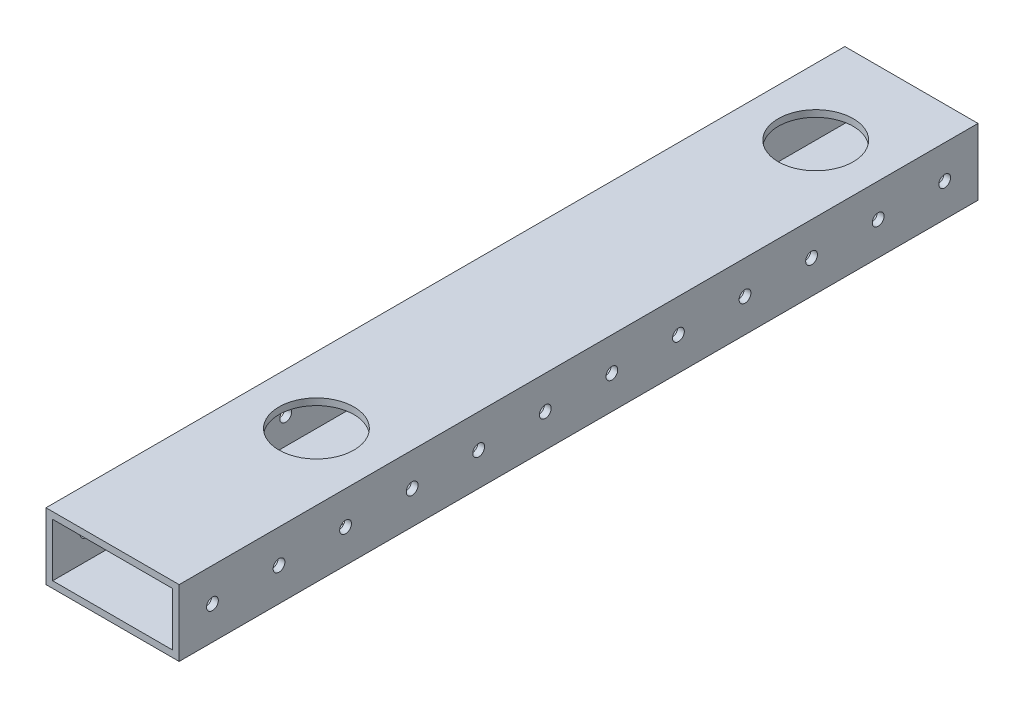
from build123d import *

# Parameters (mm, degrees)
SKETCH1_W             = 50.8
SKETCH1_H             = 25.4
SKETCH1_W_2           = 45.72
SKETCH1_H_2           = 20.32
BOSS_EXTRUDE1_DEPTH   = 533.4
F_8_CLEARANCE_HOLE1_D = 4.4958
CUT_EXTRUDE2_DEPTH    = 76.962
SKETCH5_R             = 14.2875
CUT_EXTRUDE3_DEPTH    = 452.12


with BuildPart() as part:
    # Sketch1 → Boss-Extrude1 (new body)
    with BuildSketch(Plane.XY):
        Rectangle(SKETCH1_W, SKETCH1_H)
        Rectangle(SKETCH1_W_2, SKETCH1_H_2, mode=Mode.SUBTRACT)
    extrude(amount=-BOSS_EXTRUDE1_DEPTH)

    # #8 Clearance Hole1 (through all)
    with Locations(Plane(origin=(25.4, 0, 0), x_dir=(0, 0, -1), z_dir=(1, 0, 0))):
        with Locations((12.7, 0), (38.1, 0), (63.5, 0), (88.9, 0), (114.3, 0), (139.7, 0), (165.1, 0), (190.5, 0), (215.9, 0), (241.3, 0), (266.7, 0), (292.1, 0), (317.5, 0), (342.9, 0), (368.3, 0), (393.7, 0), (419.1, 0), (444.5, 0), (469.9, 0), (495.3, 0), (520.7, 0)):
            Hole(F_8_CLEARANCE_HOLE1_D / 2)

    # Sketch4 → Cut-Extrude2 (cut)
    with BuildSketch(Plane(origin=(0, 12.7, 0), x_dir=(1, 0, 0), z_dir=(0, 1, 0))):
        Polygon((-7.206301081, 228.6), (135.513081356, 228.6), (135.513081356, -17.641370014), (-94.056886123, -17.641370014), (-94.056886123, 228.6), align=None)
    extrude(amount=-CUT_EXTRUDE2_DEPTH, mode=Mode.SUBTRACT)

    # Sketch5 → Cut-Extrude3 (cut)
    with BuildSketch(Plane(origin=(0, 12.7, 0), x_dir=(1, 0, 0), z_dir=(0, 1, 0))):
        with Locations((0, 496.8875)):
            Circle(SKETCH5_R)
        with Locations((0, 306.3875)):
            Circle(SKETCH5_R)
    extrude(amount=-CUT_EXTRUDE3_DEPTH, mode=Mode.SUBTRACT)


solid = part.part
